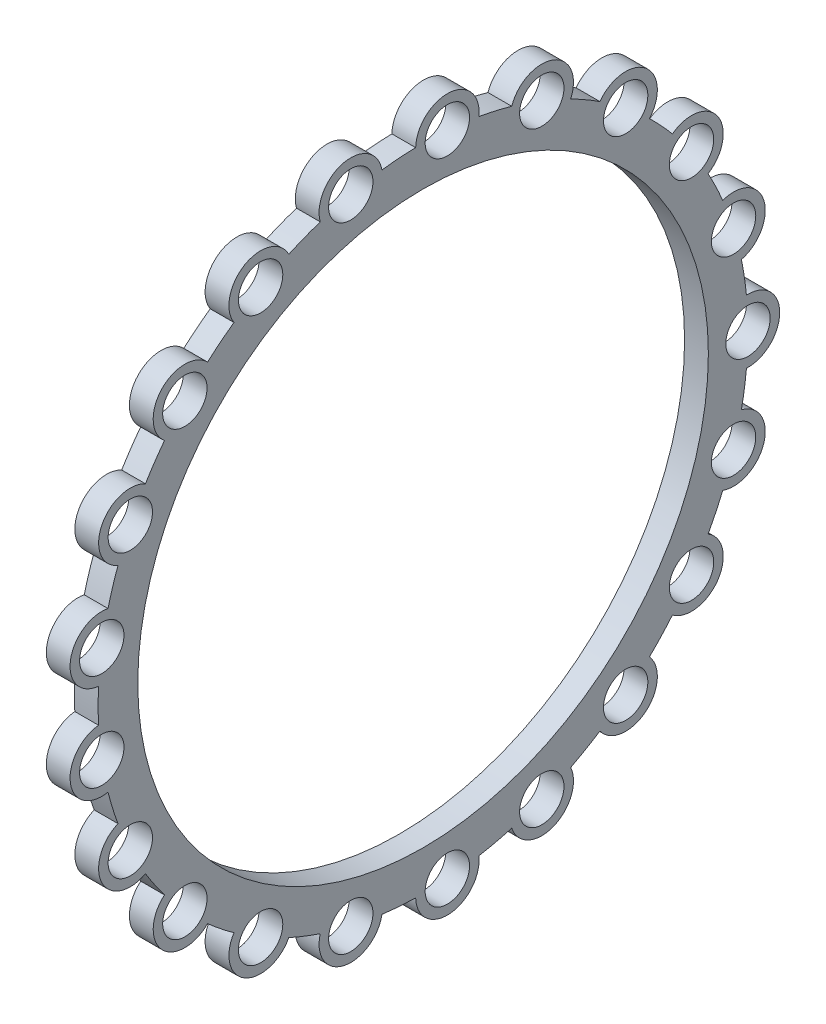
from build123d import *

# Parameters (mm, degrees)
LINEAR_AUSTRAGEN_D_NN1_OUTLINE_R = 36
LINEAR_AUSTRAGEN_D_NN1_DEPTH     = 3
F_5_6_5_6_DURCHMESSER_BOHRUNG1_D = 5.6
KREISMUSTER1_COUNT               = 21


# Read off the part's stored shape, not the designer's step: Linear-Austragen-Dünn1
with BuildPart() as part:
    # Linear-Austragen-Dünn1 outline → Linear-Austragen-Dünn1 (new body)
    with BuildSketch(Plane(origin=(0, 0, 0), x_dir=(0, 0, -1), z_dir=(1, 0, 0))):
        with BuildLine():
            ThreePointArc((40.804878049, -3.995238094), (45, 0), (40.804878049, 3.995238094))
            ThreePointArc((40.804878049, 3.995238094), (40.542063875, 6.110732913), (40.169648908, 8.209708071))
            ThreePointArc((40.169648908, 8.209708071), (43.00077626, 13.263982848), (37.814414706, 15.845189821))
            ThreePointArc((37.814414706, 15.845189821), (36.939723584, 17.789233304), (35.96517018, 19.685185646))
            ThreePointArc((35.96517018, 19.685185646), (37.180744844, 25.349402613), (31.46397467, 26.287226897))
            ThreePointArc((31.46397467, 26.287226897), (30.055126745, 27.887082249), (28.565028251, 29.411548089))
            ThreePointArc((28.565028251, 29.411548089), (28.057041084, 35.182416711), (22.317822408, 34.393528504))
            ThreePointArc((22.317822408, 34.393528504), (20.5, 35.507041555), (18.626758206, 36.524565415))
            ThreePointArc((18.626758206, 36.524565415), (16.440346096, 41.889318689), (11.188633685, 39.44381417))
            ThreePointArc((11.188633685, 39.44381417), (9.123358292, 39.972044399), (7.033418953, 40.392214817))
            ThreePointArc((7.033418953, 40.392214817), (3.362854211, 44.874170873), (-0.934714242, 40.98934385))
            ThreePointArc((-0.934714242, 40.98934385), (-3.063933837, 40.885355684), (-5.18487044, 40.670838675))
            ThreePointArc((-5.18487044, 40.670838675), (-10.013442028, 43.871756048), (-12.975008707, 38.892790451))
            ThreePointArc((-12.975008707, 38.892790451), (-14.978981999, 38.165823694), (-16.942461341, 37.335680035))
            ThreePointArc((-16.942461341, 37.335680035), (-22.5, 38.97114317), (-23.862416708, 33.340441942))
            ThreePointArc((-23.862416708, 33.340441942), (-25.563081876, 32.055090781), (-27.194640201, 30.68308238))
            ThreePointArc((-27.194640201, 30.68308238), (-32.987334232, 30.6077732), (-32.629544266, 24.825648854))
            ThreePointArc((-32.629544266, 24.825648854), (-33.875789747, 23.096122381), (-35.030455938, 21.304158204))
            ThreePointArc((-35.030455938, 21.304158204), (-40.543599056, 19.52476826), (-38.497393623, 14.10498792))
            ThreePointArc((-38.497393623, 14.10498792), (-39.178485037, 12.084962151), (-39.753661936, 10.03226608))
            ThreePointArc((-39.753661936, 10.03226608), (-44.49738718, 6.706901977), (-40.944580614, 2.13103691))
            ThreePointArc((-40.944580614, 2.13103691), (-41, 0), (-40.944580614, -2.13103691))
            ThreePointArc((-40.944580614, -2.13103691), (-44.49738718, -6.706901977), (-39.753661936, -10.03226608))
            ThreePointArc((-39.753661936, -10.03226608), (-39.178485037, -12.084962151), (-38.497393623, -14.10498792))
            ThreePointArc((-38.497393623, -14.10498792), (-40.543599056, -19.52476826), (-35.030455938, -21.304158204))
            ThreePointArc((-35.030455938, -21.304158204), (-33.875789747, -23.096122381), (-32.629544266, -24.825648854))
            ThreePointArc((-32.629544266, -24.825648854), (-32.987334232, -30.6077732), (-27.194640201, -30.68308238))
            ThreePointArc((-27.194640201, -30.68308238), (-25.563081876, -32.055090781), (-23.862416708, -33.340441942))
            ThreePointArc((-23.862416708, -33.340441942), (-22.5, -38.97114317), (-16.942461341, -37.335680035))
            ThreePointArc((-16.942461341, -37.335680035), (-14.978981999, -38.165823694), (-12.975008707, -38.892790451))
            ThreePointArc((-12.975008707, -38.892790451), (-10.013442028, -43.871756048), (-5.18487044, -40.670838675))
            ThreePointArc((-5.18487044, -40.670838675), (-3.063933837, -40.885355684), (-0.934714242, -40.98934385))
            ThreePointArc((-0.934714242, -40.98934385), (3.362854211, -44.874170873), (7.033418953, -40.392214817))
            ThreePointArc((7.033418953, -40.392214817), (9.123358292, -39.972044399), (11.188633685, -39.44381417))
            ThreePointArc((11.188633685, -39.44381417), (16.440346096, -41.889318689), (18.626758206, -36.524565415))
            ThreePointArc((18.626758206, -36.524565415), (20.5, -35.507041555), (22.317822408, -34.393528504))
            ThreePointArc((22.317822408, -34.393528504), (28.057041084, -35.182416711), (28.565028251, -29.411548089))
            ThreePointArc((28.565028251, -29.411548089), (30.055126745, -27.887082249), (31.46397467, -26.287226897))
            ThreePointArc((31.46397467, -26.287226897), (37.180744844, -25.349402613), (35.96517018, -19.685185646))
            ThreePointArc((35.96517018, -19.685185646), (36.939723584, -17.789233304), (37.814414706, -15.845189821))
            ThreePointArc((37.814414706, -15.845189821), (43.00077626, -13.263982848), (40.169648908, -8.209708071))
            ThreePointArc((40.169648908, -8.209708071), (40.542063875, -6.110732913), (40.804878049, -3.995238094))
        make_face()
        Circle(LINEAR_AUSTRAGEN_D_NN1_OUTLINE_R, mode=Mode.SUBTRACT)
    extrude(amount=LINEAR_AUSTRAGEN_D_NN1_DEPTH)

    # Ø5.6 (5.6) Durchmesser Bohrung1 (through all)
    with Locations(Plane(origin=(3, 0, 0), x_dir=(0, 0, -1), z_dir=(1, 0, 0))):
        with Locations((41, 0)):
            f_5_6_5_6_durchmesser_bohrung1 = Hole(F_5_6_5_6_DURCHMESSER_BOHRUNG1_D / 2)

    # Kreismuster1: Ø5.6 (5.6) Durchmesser Bohrung1 ×21 about axis
    kreismuster1_axis = Axis((0, 0, 0), (1, 0, 0))
    for i in range(1, KREISMUSTER1_COUNT):
        add(f_5_6_5_6_durchmesser_bohrung1.rotate(kreismuster1_axis, i * 360 / KREISMUSTER1_COUNT), mode=Mode.SUBTRACT)


solid = part.part
